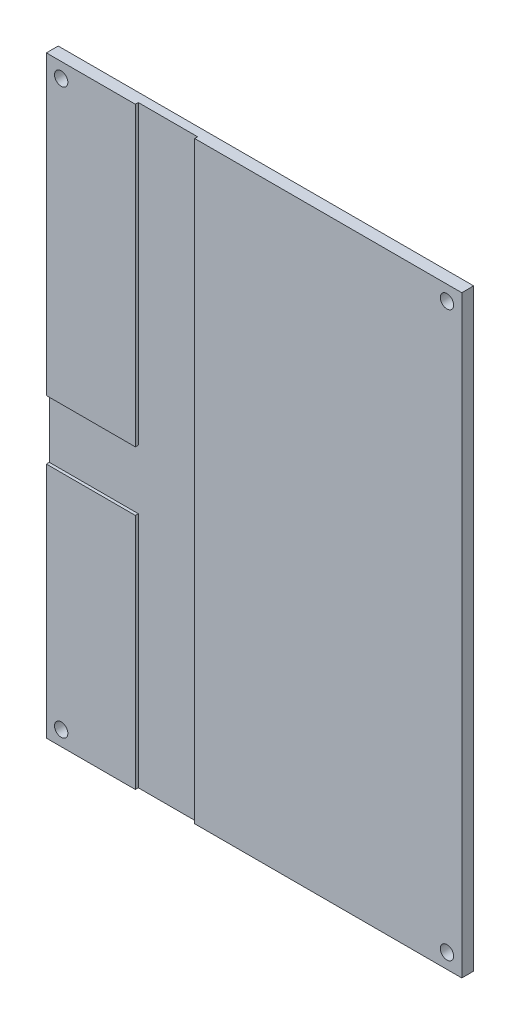
from build123d import *

# Parameters (mm, degrees)
SKETCH1_W                      = 140
SKETCH1_H                      = 200
BODY_DEPTH                     = 4
CABLE_CANAL_DEPTH              = 1
MOUNTING_SCREW_HOLES_OUTLINE_R = 2.25
MOUNTING_SCREW_HOLES_DEPTH     = 4


# Read off the part's stored shape, not the designer's step: mounting_screw_holes
with BuildPart() as part:
    # Sketch1 → body (new body)
    with BuildSketch(Plane.XY):
        Rectangle(SKETCH1_W, SKETCH1_H)
    extrude(amount=BODY_DEPTH)

    # Sketch2 → cable_canal (cut)
    with BuildSketch(Plane.XY.offset(4)):
        Polygon((-40, 100), (-40, 0), (-70, 0), (-70, -20), (-40, -20), (-40, -100), (-20, -100), (-20, 100), align=None)
    extrude(amount=-CABLE_CANAL_DEPTH, mode=Mode.SUBTRACT)

    # mounting_screw_holes outline → mounting_screw_holes (cut)
    with BuildSketch(Plane.XY):
        with Locations((65, 95)):
            Circle(MOUNTING_SCREW_HOLES_OUTLINE_R)
        with Locations((-65, -95)):
            Circle(MOUNTING_SCREW_HOLES_OUTLINE_R)
        with Locations((65, -95)):
            Circle(MOUNTING_SCREW_HOLES_OUTLINE_R)
        with Locations((-65, 95)):
            Circle(MOUNTING_SCREW_HOLES_OUTLINE_R)
    extrude(amount=MOUNTING_SCREW_HOLES_DEPTH, mode=Mode.SUBTRACT)


solid = part.part
